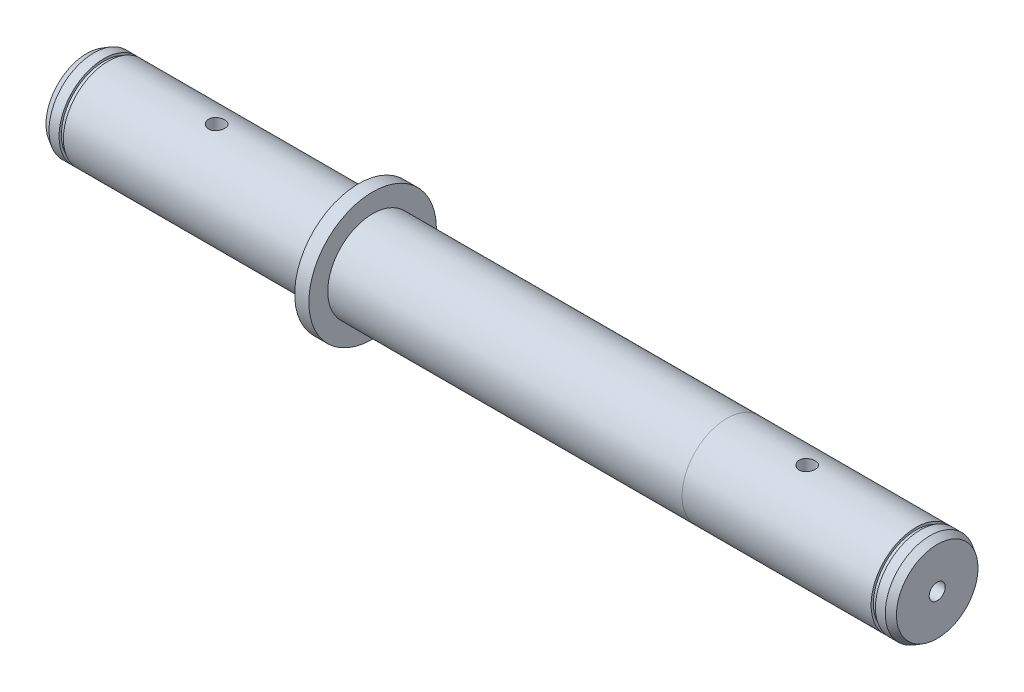
from build123d import *
from OCP.BRepFilletAPI import BRepFilletAPI_MakeChamfer

# Parameters (mm, degrees)
M8_TAPPED_HOLE1_D             = 6.8
M8_TAPPED_HOLE1_DEPTH         = 65
M8_TAPPED_HOLE1_TIP           = 2.042926105
SKIZZE18_W                    = 3.4
SKIZZE18_H                    = 27
M8_GEWINDEBOHRUNG3_AT_2_COUNT = 2
M8_GEWINDEBOHRUNG3_AT_2_PITCH = 250
SPIEGELN2_COPY_1_SKETCH_W     = 3.4
SPIEGELN2_COPY_1_SKETCH_H     = 27
SKIZZE19_W                    = 1.85
SKIZZE19_H                    = 1
SKIZZE20_W                    = 1.85
SKIZZE20_H                    = 1
M8_TAPPED_HOLE2_D             = 6.8
M8_TAPPED_HOLE2_DEPTH         = 65
M8_TAPPED_HOLE2_TIP           = 2.042926105
FASE1_SIZE                    = 3
FASE1_SIZE2                   = 1.732050808


with BuildPart() as part:
    # Skizze1 → Rotation1 (revolve)
    with BuildSketch(Plane.XY):
        Polygon((180, 19), (180, 0), (-180, 0), (-180, 19), (-65, 19), (-65, 27), (-59, 27), (-59, 19.0001), (91, 19.0001), align=None)
    revolve(axis=Axis((180, 0, 0), (-1, 0, 0)))

    # M8 Tapped Hole1
    with Locations(Plane(origin=(180, 0, 0), x_dir=(0, 0, -1), z_dir=(1, 0, 0))):
        with Locations((0, 0)):
            Hole(M8_TAPPED_HOLE1_D / 2, depth=M8_TAPPED_HOLE1_DEPTH)
            with Locations((0, 0, -(M8_TAPPED_HOLE1_DEPTH + M8_TAPPED_HOLE1_TIP / 2))):  # 118° drill point
                Cone(0, M8_TAPPED_HOLE1_D / 2, M8_TAPPED_HOLE1_TIP, mode=Mode.SUBTRACT)

    # Skizze18 → M8 Gewindebohrung3 (revolve, cut)
    with BuildSketch(Plane(origin=(-125, 0, 0), x_dir=(0, 0, -1), z_dir=(1, 0, 0))):
        with Locations((1.7, 13.5)):
            Rectangle(SKIZZE18_W, SKIZZE18_H)
    m8_gewindebohrung3 = revolve(axis=Axis((-125, -6.35, 0), (0, 1, 0)), mode=Mode.SUBTRACT)

    # M8 Gewindebohrung3 at 2: M8 Gewindebohrung3 ×2
    with Locations(*[(i * M8_GEWINDEBOHRUNG3_AT_2_PITCH, 0, 0) for i in range(1, M8_GEWINDEBOHRUNG3_AT_2_COUNT)]):
        add(m8_gewindebohrung3, mode=Mode.SUBTRACT)

    # Spiegeln2: M8 Gewindebohrung3 across plane
    add(m8_gewindebohrung3.mirror(Plane.ZX), mode=Mode.SUBTRACT)

    # Spiegeln2 copy 1 sketch → Spiegeln2 copy 1 (revolve, cut)
    with BuildSketch(Plane(origin=(125, 0, 0), x_dir=(0, 0, -1), z_dir=(1, 0, 0))):
        with Locations((1.7, -13.5)):
            Rectangle(SPIEGELN2_COPY_1_SKETCH_W, SPIEGELN2_COPY_1_SKETCH_H)
    revolve(axis=Axis((125, 6.35, 0), (0, 1, 0)), mode=Mode.SUBTRACT)

    # Skizze19 → Schnitt-Rotation1 (revolve, cut)
    with BuildSketch(Plane.XY):
        with Locations((171.925, 18.5)):
            Rectangle(SKIZZE19_W, SKIZZE19_H)
    revolve(axis=Axis((-88.99, 0, 0), (1, 0, 0)), mode=Mode.SUBTRACT)

    # Skizze20 → Schnitt-Rotation2 (revolve, cut)
    with BuildSketch(Plane.XY):
        with Locations((-171.825, 18.5)):
            Rectangle(SKIZZE20_W, SKIZZE20_H)
    revolve(axis=Axis((-88.99, 0, 0), (1, 0, 0)), mode=Mode.SUBTRACT)

    # M8 Tapped Hole2
    with Locations(Plane.ZY.offset(180)):
        with Locations((0, 0)):
            Hole(M8_TAPPED_HOLE2_D / 2, depth=M8_TAPPED_HOLE2_DEPTH)
            with Locations((0, 0, -(M8_TAPPED_HOLE2_DEPTH + M8_TAPPED_HOLE2_TIP / 2))):  # 118° drill point
                Cone(0, M8_TAPPED_HOLE2_D / 2, M8_TAPPED_HOLE2_TIP, mode=Mode.SUBTRACT)

    # Fase1: one chamfer whose edges measure the first distance from different faces: ONE call of the kernel's chamfer builder (chamfer() names one face for all edges)
    fase1_edges_1 = [part.edges().sort_by_distance(p)[0] for p in [
        (180, -19, 0),
    ]]
    fase1_side_1 = [part.faces().sort_by_distance(p)[0] for p in [
        (176.425, -19.0001, 0),
    ]]
    fase1_edges_2 = [part.edges().sort_by_distance(p)[0] for p in [
        (-180, -19, 0),
    ]]
    fase1_side_2 = [part.faces().sort_by_distance(p)[0] for p in [
        (-176.375, -19, 0),
    ]]
    fase1 = BRepFilletAPI_MakeChamfer(part.part.solid().wrapped)
    for e in fase1_edges_1:
        fase1.Add(FASE1_SIZE, FASE1_SIZE2, e.wrapped, fase1_side_1[0].wrapped)  # the first distance lies on this face
    for e in fase1_edges_2:
        fase1.Add(FASE1_SIZE, FASE1_SIZE2, e.wrapped, fase1_side_2[0].wrapped)  # the first distance lies on this face
    add(Compound.cast(fase1.Shape()), mode=Mode.REPLACE)


solid = part.part
